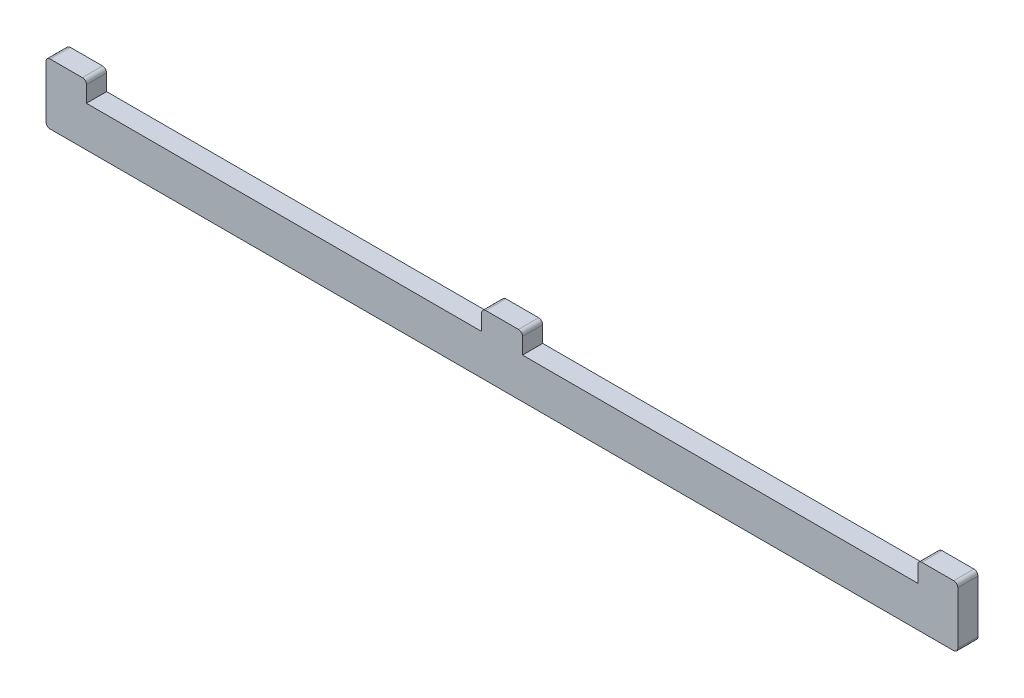
from build123d import *

# Parameters (mm, degrees)
BOSS_EXTRUDE1_DEPTH = 5


with BuildPart() as part:
    # Sketch1 → Boss-Extrude1 (new body)
    with BuildSketch(Plane.XY):
        with BuildLine():
            Line((117.9, 10), (215.7, 10))
            Line((215.7, 10), (215.7, 14))
            ThreePointArc((215.7, 14), (215.992893219, 14.707106781), (216.7, 15))
            Line((216.7, 15), (224.6, 15))
            ThreePointArc((224.6, 15), (225.307106781, 14.707106781), (225.6, 14))
            Line((225.6, 14), (225.6, 1))
            ThreePointArc((225.6, 1), (225.307106781, 0.292893219), (224.6, 0))
            Line((224.6, 0), (1, 0))
            ThreePointArc((1, 0), (0.292893219, 0.292893219), (0, 1))
            Line((0, 1), (0, 14))
            ThreePointArc((0, 14), (0.292893219, 14.707106781), (1, 15))
            Line((1, 15), (9, 15))
            ThreePointArc((9, 15), (9.707106781, 14.707106781), (10, 14))
            Line((10, 14), (10, 10))
            Line((10, 10), (107.8, 10))
            Line((107.8, 10), (107.8, 14))
            ThreePointArc((107.8, 14), (108.092893219, 14.707106781), (108.8, 15))
            Line((108.8, 15), (116.9, 15))
            ThreePointArc((116.9, 15), (117.607106781, 14.707106781), (117.9, 14))
            Line((117.9, 14), (117.9, 10))
        make_face()
    extrude(amount=BOSS_EXTRUDE1_DEPTH)


solid = part.part
